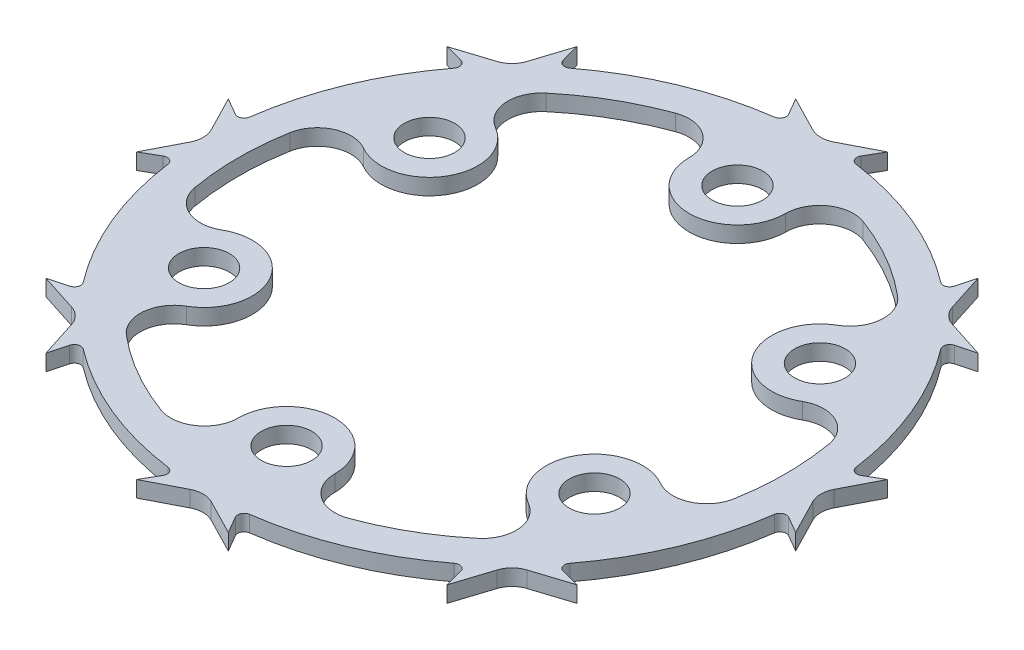
from build123d import *

# Parameters (mm, degrees)
SKETCH1_R                = 30.1625
SKETCH1_R_2              = 26.9875
BOSS_EXTRUDE1_DEPTH      = 1.5875
BOSS_EXTRUDE2_START      = -1.5875
SKETCH2_R                = 2.4892
BOSS_EXTRUDE2_DEPTH      = 1.5875
CIRPATTERN1_COUNT        = 6
BOSS_EXTRUDE3_START      = -1.5875
BOSS_EXTRUDE3_DEPTH      = 1.5875
FILLET1_R                = 2.286
FILLET2_R                = 1.524
FILLET3_R                = 0.635
CIRPATTERN2_COUNT        = 8
FILLET1_OF_CIRPATTERN2_R = 2.286
FILLET2_OF_CIRPATTERN2_R = 1.524
FILLET3_OF_CIRPATTERN2_R = 0.635


with BuildPart() as part:
    # Sketch1 → Boss-Extrude1 (new body)
    with BuildSketch(Plane(origin=(0, 0, 0), x_dir=(1, 0, 0), z_dir=(0, 1, 0))):
        with Locations(Location((0, 0, 0), (0, 0, 270))):
            Circle(SKETCH1_R)
        with Locations(Location((0, 0, 0), (0, 0, 270))):
            Circle(SKETCH1_R_2, mode=Mode.SUBTRACT)
    extrude(amount=BOSS_EXTRUDE1_DEPTH)

    # Sketch2 → Boss-Extrude2 (add)
    with BuildSketch(Plane(origin=(0, 1.5875, 0), x_dir=(1, 0, 0), z_dir=(0, 1, 0)).offset(BOSS_EXTRUDE2_START)):
        with BuildLine():
            ThreePointArc((-9.237332215, 25.35738255), (-6.184469909, 24.956114415), (-4.7625, 22.225))
            ThreePointArc((-4.7625, 22.225), (0, 17.4625), (4.7625, 22.225))
            ThreePointArc((4.7625, 22.225), (6.184469909, 24.956114415), (9.237332215, 25.35738255))
            ThreePointArc((9.237332215, 25.35738255), (0, 26.9875), (-9.237332215, 25.35738255))
        make_face()
        with Locations(Location((0, 22.225, 0), (0, 0, 270))):
            Circle(SKETCH2_R, mode=Mode.SUBTRACT)
    boss_extrude2 = extrude(amount=BOSS_EXTRUDE2_DEPTH)

    # CirPattern1: Boss-Extrude2 ×6 about axis
    cirpattern1_axis = Axis((0, 0, 0), (0, 1, 0))
    for i in range(1, CIRPATTERN1_COUNT):
        add(boss_extrude2.rotate(cirpattern1_axis, i * 360 / CIRPATTERN1_COUNT))

    # Sketch3 → Boss-Extrude3 (add)
    with BuildSketch(Plane(origin=(0, 1.5875, 0), x_dir=(1, 0, 0), z_dir=(0, 1, 0)).offset(BOSS_EXTRUDE3_START)):
        with BuildLine():
            Line((4.517012817, 32.486934384), (0, 30.1625))
            ThreePointArc((0, 30.1625), (1.589709482, 30.120578182), (3.175, 29.994929259))
            ThreePointArc((3.175, 29.994929259), (3.206558857, 30.078714629), (3.175, 30.1625))
            Line((3.175, 30.1625), (4.517012817, 32.486934384))
        make_face()
        with BuildLine():
            Line((-4.517012817, 32.486934384), (-3.175, 30.1625))
            ThreePointArc((-3.175, 30.1625), (-3.206558857, 30.078714629), (-3.175, 29.994929259))
            ThreePointArc((-3.175, 29.994929259), (-1.589709482, 30.120578182), (0, 30.1625))
            Line((0, 30.1625), (-4.517012817, 32.486934384))
        make_face()
    boss_extrude3 = extrude(amount=BOSS_EXTRUDE3_DEPTH)

    # Fillet1
    fillet1_edges = [part.edges().sort_by_distance(p)[0] for p in [
        (0, 0.79375, -30.1625),
    ]]
    fillet(fillet1_edges, radius=FILLET1_R)

    # Fillet2
    # the kernel refuses this fillet: 1.524 mm, written as the material it adds along each edge
    with BuildSketch(Plane(origin=(3.175, 0, -29.994929259), x_dir=(0, 0, -1), z_dir=(0, 1, 0))) as fillet2_piece_1:
        with BuildLine():
            CenterArc((1.435454488, -0.845604401), FILLET2_R, 146.299028695, 26.411231524)
            Line((-0.076227295, -0.652228639), (-0.106460931, -0.648361123))
            ThreePointArc((-0.106460931, -0.648361123), (-0.06661258, -0.322783591), (-0.030310665, 0.003208421))
            Line((-0.030310665, 0.003208421), (0.020108489, 0.022905874))
            ThreePointArc((0.020108489, 0.022905874), (0.083785371, -0.001078857), (0.142213066, 0.016912088))
            Line((0.142213066, 0.016912088), (0.167570741, 0))
        make_face()
    extrude(amount=1.5875)
    with BuildSketch(Plane(origin=(-3.175, 0, -29.994929259), x_dir=(-0.9932396393904435, 0, 0.11608194839656201), z_dir=(0, 1, 0))) as fillet2_piece_2:
        with BuildLine():
            CenterArc((0.673257457, -1.523909705), FILLET2_R, 90.623705681, 26.411231524)
            Line((-0.019451938, -0.166437902), (-0.033306126, -0.139288466))
            ThreePointArc((-0.033306126, -0.139288466), (-0.008654405, -0.083344187), (-0.025085255, -0.01731359))
            Line((-0.025085255, -0.01731359), (0.00033179, 0.030478194))
            ThreePointArc((0.00033179, 0.030478194), (0.328333975, 0.028692907), (0.656336161, 0.030478194))
            Line((0.656336161, 0.030478194), (0.656667951, 0))
        make_face()
    extrude(amount=1.5875)

    # Fillet3
    fillet3_edges = [part.edges().sort_by_distance(p)[0] for p in [
        (-3.175, 0.79375, -30.1625),
        (3.175, 0.79375, -30.1625),
    ]]
    fillet(fillet3_edges, radius=FILLET3_R)

    # CirPattern2: Boss-Extrude3 ×8 about axis
    cirpattern2_axis = Axis((0, 0, 0), (0, 1, 0))
    for i in range(1, CIRPATTERN2_COUNT):
        add(boss_extrude3.rotate(cirpattern2_axis, i * 360 / CIRPATTERN2_COUNT))

    # Fillet1 of CirPattern2
    fillet1_of_cirpattern2_edges = [part.edges().sort_by_distance(p)[0] for p in [
        (-21.328108288, 0.79375, -21.328108288),
        (-30.1625, 0.79375, 0),
        (-21.328108288, 0.79375, 21.328108288),
        (0, 0.79375, 30.1625),
        (21.328108288, 0.79375, 21.328108288),
        (30.1625, 0.79375, 0),
        (21.328108288, 0.79375, -21.328108288),
    ]]
    fillet(fillet1_of_cirpattern2_edges, radius=FILLET1_OF_CIRPATTERN2_R)

    # Fillet2 of CirPattern2
    # the kernel refuses this fillet: 1.524 mm, written as the material it adds along each edge
    with BuildSketch(Plane(origin=(-18.96455385, 0, -23.45468191), x_dir=(0.7844088172408243, 0, -0.6202441514717015), z_dir=(0, 1, 0)), Plane(origin=(-29.994929259, 0, -3.175), x_dir=(0.11608194839659203, 0, -0.9932396393904398), z_dir=(0, 1, 0)), Plane(origin=(-23.45468191, 0, 18.96455385), x_dir=(-0.620244151471689, 0, -0.7844088172408342), z_dir=(0, 1, 0))) as fillet2_of_cirpattern2_piece_1:
        with BuildLine():
            CenterArc((0.673257457, 1.523909705), FILLET2_OF_CIRPATTERN2_R, 242.965062795, 26.411231524)
            Line((-0.019451938, 0.166437902), (-0.033306126, 0.139288466))
            ThreePointArc((-0.033306126, 0.139288466), (-0.008654405, 0.083344187), (-0.025085255, 0.01731359))
            Line((-0.025085255, 0.01731359), (0.00033179, -0.030478194))
            ThreePointArc((0.00033179, -0.030478194), (0.328333975, -0.028692907), (0.656336161, -0.030478194))
            Line((0.656336161, -0.030478194), (0.656667951, 0))
        make_face()
    extrude(amount=1.5875)
    with BuildSketch(Plane(origin=(-23.45468191, 0, -18.96455385), x_dir=(-0.7071067811865793, 0, -0.7071067811865157), z_dir=(0, 1, 0)), Plane(origin=(-29.994929259, 0, 3.175), x_dir=(-1, 0, 0), z_dir=(0, 1, 0)), Plane(origin=(18.96455385, 0, -23.45468191), x_dir=(0.7071067811865369, 0, -0.7071067811865581), z_dir=(0, 1, 0))) as fillet2_of_cirpattern2_piece_2:
        with BuildLine():
            CenterArc((1.435454488, 0.845604401), FILLET2_OF_CIRPATTERN2_R, 187.289739781, 26.411231524)
            Line((-0.076227295, 0.652228639), (-0.106460931, 0.648361123))
            ThreePointArc((-0.106460931, 0.648361123), (-0.06661258, 0.322783591), (-0.030310665, -0.003208421))
            Line((-0.030310665, -0.003208421), (0.020108489, -0.022905874))
            ThreePointArc((0.020108489, -0.022905874), (0.083785371, 0.001078857), (0.142213066, -0.016912088))
            Line((0.142213066, -0.016912088), (0.167570741, 0))
        make_face()
    extrude(amount=1.5875)
    with BuildSketch(Plane(origin=(-18.96455385, 0, 23.45468191), x_dir=(0.784408817240829, 0, 0.6202441514716955), z_dir=(0, 1, 0)), Plane(origin=(3.175, 0, 29.994929259), x_dir=(0.9932396393904444, 0, -0.11608194839655256), z_dir=(0, 1, 0)), Plane(origin=(23.45468191, 0, 18.96455385), x_dir=(0.6202441514717251, 0, -0.7844088172408058), z_dir=(0, 1, 0)), Plane(origin=(29.994929259, 0, -3.175), x_dir=(-0.1160819483965305, 0, -0.9932396393904471), z_dir=(0, 1, 0))) as fillet2_of_cirpattern2_piece_3:
        with BuildLine():
            CenterArc((0.673257457, -1.523909705), FILLET2_OF_CIRPATTERN2_R, 90.623705681, 26.411231524)
            Line((-0.019451938, -0.166437902), (-0.033306126, -0.139288466))
            ThreePointArc((-0.033306126, -0.139288466), (-0.008654405, -0.083344187), (-0.025085255, -0.01731359))
            Line((-0.025085255, -0.01731359), (0.00033179, 0.030478194))
            ThreePointArc((0.00033179, 0.030478194), (0.328333975, 0.028692907), (0.656336161, 0.030478194))
            Line((0.656336161, 0.030478194), (0.656667951, 0))
        make_face()
    extrude(amount=1.5875)
    with BuildSketch(Plane(origin=(-3.175, 0, 29.994929259), x_dir=(0, 0, 1), z_dir=(0, 1, 0)), Plane(origin=(18.96455385, 0, 23.45468191), x_dir=(0.7071067811865263, 0, 0.7071067811865687), z_dir=(0, 1, 0)), Plane(origin=(29.994929259, 0, 3.175), x_dir=(1, 0, 0), z_dir=(0, 1, 0)), Plane(origin=(23.45468191, 0, -18.96455385), x_dir=(0.7071067811865581, 0, -0.7071067811865369), z_dir=(0, 1, 0))) as fillet2_of_cirpattern2_piece_4:
        with BuildLine():
            CenterArc((1.435454488, -0.845604401), FILLET2_OF_CIRPATTERN2_R, 146.299028695, 26.411231524)
            Line((-0.076227295, -0.652228639), (-0.106460931, -0.648361123))
            ThreePointArc((-0.106460931, -0.648361123), (-0.06661258, -0.322783591), (-0.030310665, 0.003208421))
            Line((-0.030310665, 0.003208421), (0.020108489, 0.022905874))
            ThreePointArc((0.020108489, 0.022905874), (0.083785371, -0.001078857), (0.142213066, 0.016912088))
            Line((0.142213066, 0.016912088), (0.167570741, 0))
        make_face()
    extrude(amount=1.5875)

    # Fillet3 of CirPattern2
    fillet3_of_cirpattern2_edges = [part.edges().sort_by_distance(p)[0] for p in [
        (-23.573172318, 0.79375, -19.083044257),
        (-19.083044257, 0.79375, -23.573172318),
        (-30.1625, 0.79375, 3.175),
        (-30.1625, 0.79375, -3.175),
        (-19.083044257, 0.79375, 23.573172318),
        (-23.573172318, 0.79375, 19.083044257),
        (3.175, 0.79375, 30.1625),
        (-3.175, 0.79375, 30.1625),
        (23.573172318, 0.79375, 19.083044257),
        (19.083044257, 0.79375, 23.573172318),
        (30.1625, 0.79375, -3.175),
        (30.1625, 0.79375, 3.175),
        (19.083044257, 0.79375, -23.573172318),
        (23.573172318, 0.79375, -19.083044257),
    ]]
    fillet(fillet3_of_cirpattern2_edges, radius=FILLET3_OF_CIRPATTERN2_R)


solid = part.part
